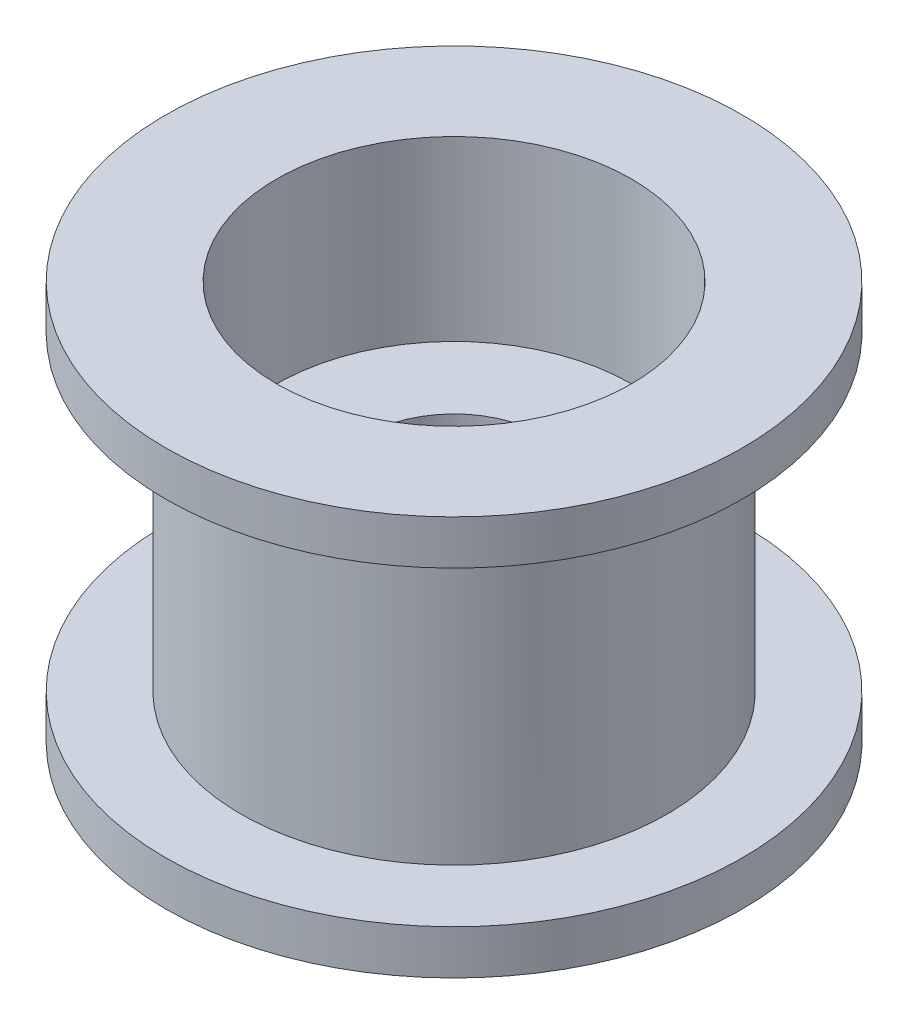
from build123d import *

# Parameters (mm, degrees)
SKETCH2_R           = 4.8
BOSS_EXTRUDE1_DEPTH = 3.5
SKETCH3_R           = 6.5
BOSS_EXTRUDE2_DEPTH = 1
SKETCH4_R           = 4
CUT_EXTRUDE1_DEPTH  = 4
SKETCH5_R           = 2
CUT_EXTRUDE2_DEPTH  = 11.464224768


with BuildPart() as part:
    # Sketch2 → Boss-Extrude1 (new, symmetric)
    with BuildSketch(Plane(origin=(0, 0, 0), x_dir=(1, 0, 0), z_dir=(0, 1, 0))):
        Circle(SKETCH2_R)
    extrude(amount=BOSS_EXTRUDE1_DEPTH, both=True)

    # Sketch3 → Boss-Extrude2 (add)
    with BuildSketch(Plane(origin=(0, 3.5, 0), x_dir=(1, 0, 0), z_dir=(0, 1, 0))):
        Circle(SKETCH3_R)
    boss_extrude2 = extrude(amount=BOSS_EXTRUDE2_DEPTH)

    # Sketch4 → Cut-Extrude1 (cut)
    with BuildSketch(Plane(origin=(0, 4.5, 0), x_dir=(1, 0, 0), z_dir=(0, 1, 0))):
        Circle(SKETCH4_R)
    cut_extrude1 = extrude(amount=-CUT_EXTRUDE1_DEPTH, mode=Mode.SUBTRACT)

    # Mirror1: Boss-Extrude2, Cut-Extrude1 across plane
    add(boss_extrude2.mirror(Plane.ZX))
    add(cut_extrude1.mirror(Plane.ZX), mode=Mode.SUBTRACT)

    # Sketch5 → Cut-Extrude2 (cut, through all)
    with BuildSketch(Plane(origin=(0, 0.5, 0), x_dir=(1, 0, 0), z_dir=(0, 1, 0))):
        Circle(SKETCH5_R)
    extrude(amount=-CUT_EXTRUDE2_DEPTH, mode=Mode.SUBTRACT)


solid = part.part
